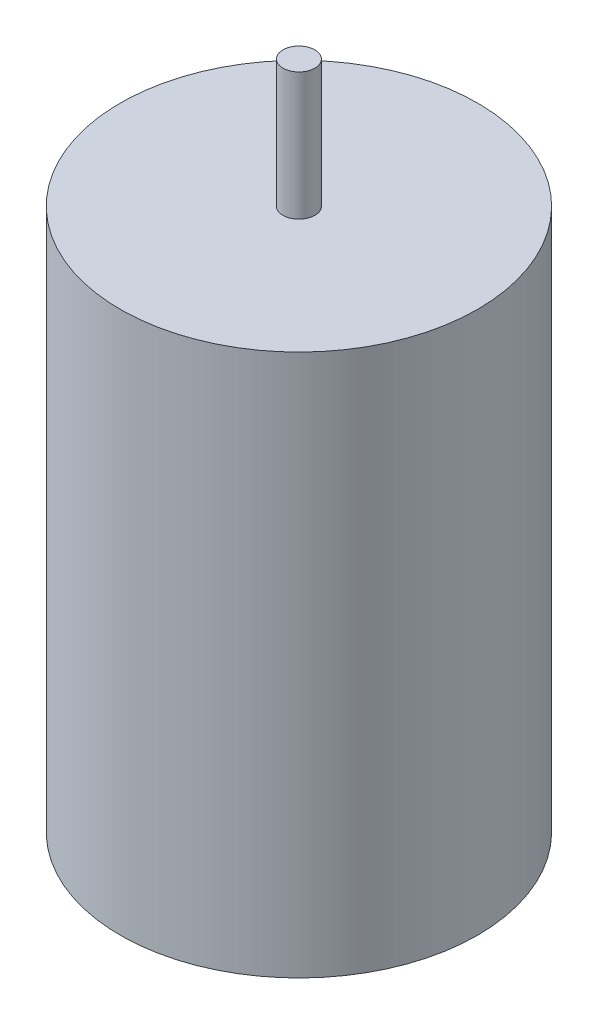
from build123d import *


with BuildPart() as part:
    # Sketch1 → Revolve1 (revolve)
    with BuildSketch(Plane.XY):
        Polygon((0, 66.7), (1.585, 66.7), (1.585, 54), (17.8, 54), (17.8, 0), (0, 0), align=None)
    revolve(axis=Axis((0, -66.7, 0), (0, 1, 0)))


solid = part.part
